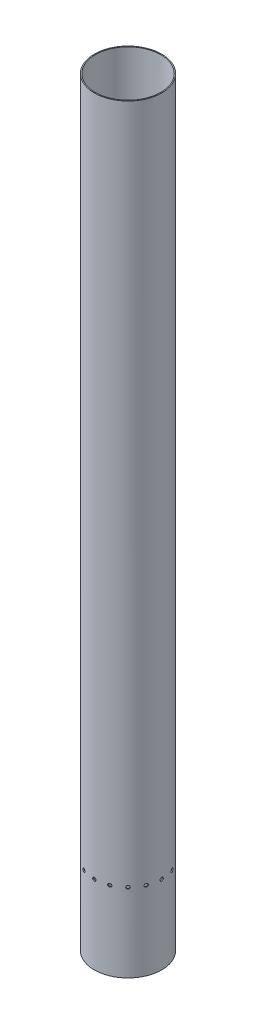
from build123d import *

# Parameters (mm, degrees)
SKETCH1_R           = 65.405
SKETCH1_R_2         = 63.5
BOSS_EXTRUDE1_DEPTH = 1473.2
CUT_EXTRUDE1_REACH  = 1482.442
SKETCH2_R           = 3.175
CIRPATTERN1_COUNT   = 16


with BuildPart() as part:
    # Sketch1 → Boss-Extrude1 (new body)
    with BuildSketch(Plane(origin=(0, 0, 0), x_dir=(1, 0, 0), z_dir=(0, 1, 0))):
        Circle(SKETCH1_R)
        Circle(SKETCH1_R_2, mode=Mode.SUBTRACT)
    extrude(amount=-BOSS_EXTRUDE1_DEPTH)

    # Sketch2 → Cut-Extrude1 (cut, up to next)
    with BuildSketch(Plane.XY.offset(65.405), mode=Mode.PRIVATE) as cut_extrude1_sk1:
        with Locations((0, -1320.8)):
            Circle(SKETCH2_R)
    cut_extrude1_tool1 = extrude(cut_extrude1_sk1.sketch, amount=-CUT_EXTRUDE1_REACH, mode=Mode.PRIVATE) & part.part
    cut_extrude1 = cut_extrude1_tool1.solids().sort_by_distance((0, -1320.8, 65.405))[0]
    add(cut_extrude1, mode=Mode.SUBTRACT)

    # CirPattern1: Cut-Extrude1 ×16 about axis
    cirpattern1_axis = Axis((0, -1473.2, 0), (0, 1, 0))
    for i in range(1, CIRPATTERN1_COUNT):
        add(cut_extrude1.rotate(cirpattern1_axis, i * 360 / CIRPATTERN1_COUNT), mode=Mode.SUBTRACT)


solid = part.part
